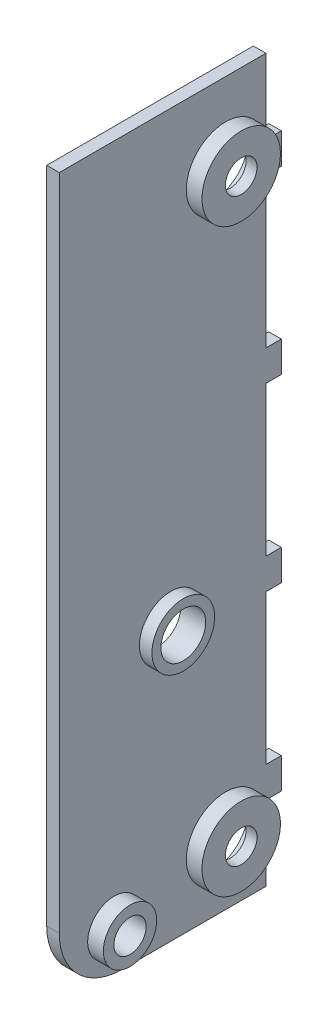
from build123d import *

# Parameters (mm, degrees)
SKETCH1_W            = 200
SKETCH1_H            = 230
BOSS_EXTRUDE1_DEPTH  = 70
SKETCH2_W            = 192
SKETCH2_H            = 222
CUT_EXTRUDE1_DEPTH   = 66
SKETCH4_W            = 196
SKETCH4_H            = 25
CUT_EXTRUDE3_DEPTH   = 10
SKETCH10_R           = 5
CUT_EXTRUDE8_DEPTH   = 167.075284133
SKETCH11_W           = 2
SKETCH11_H           = 10
BOSS_EXTRUDE2_DEPTH  = 20
SKETCH12_W           = 2
SKETCH12_H           = 5
CUT_EXTRUDE9_DEPTH   = 20
FILLET1_R            = 2.5
SKETCH13_W           = 2
SKETCH13_H           = 10
BOSS_EXTRUDE3_DEPTH  = 20
SKETCH14_W           = 2
SKETCH14_H           = 5
CUT_EXTRUDE10_DEPTH  = 20
FILLET2_R            = 2.5
SKETCH15_W           = 192
SKETCH15_H           = 66
CUT_EXTRUDE11_DEPTH  = 267.458251889
BOSS_EXTRUDE4_DEPTH  = 2
SKETCH18_R           = 7.15
CUT_EXTRUDE12_DEPTH  = 248.638849941
SKETCH19_R           = 5.05
CUT_EXTRUDE13_DEPTH  = 248.638849941
SKETCH20_R           = 5.05
CUT_EXTRUDE14_DEPTH  = 248.638849941
BOSS_EXTRUDE5_START  = 2
BOSS_EXTRUDE5_DEPTH  = 2
SKETCH21_W           = 20
SKETCH21_H           = 10
CUT_EXTRUDE15_DEPTH  = 248.638849941
SKETCH22_W           = 92
SKETCH22_H           = 40
CUT_EXTRUDE16_DEPTH  = 10
SKETCH24_R           = 5.15
CUT_EXTRUDE18_DEPTH  = 242.091269025
FILLET3_R            = 20
FILLET4_R            = 20
SKETCH25_W           = 200
SKETCH25_H           = 4.119110625
CUT_EXTRUDE19_DEPTH  = 261.384331326
SKETCH26_W           = 4
SKETCH26_H           = 65.880889375
CUT_EXTRUDE20_DEPTH  = 261.384331326
SKETCH27_W           = 4
SKETCH27_H           = 9.8
BOSS_EXTRUDE6_DEPTH  = 4.9
SKETCH28_W           = 4
SKETCH28_H           = 9.8
BOSS_EXTRUDE7_DEPTH  = 4.9
SKETCH29_R           = 12.5
SKETCH29_R_2         = 5.05
BOSS_EXTRUDE8_DEPTH  = 9
SKETCH30_R           = 8.5
SKETCH30_R_2         = 5.15
BOSS_EXTRUDE9_DEPTH  = 5
SKETCH32_R           = 10
SKETCH32_R_2         = 7.15
BOSS_EXTRUDE10_DEPTH = 4
SKETCH33_R           = 11.2
CUT_EXTRUDE21_DEPTH  = 5.5


with BuildPart() as part:
    # Sketch1 → Boss-Extrude1 (new body)
    with BuildSketch(Plane.XY):
        Rectangle(SKETCH1_W, SKETCH1_H)
    extrude(amount=BOSS_EXTRUDE1_DEPTH)

    # Sketch2 → Cut-Extrude1 (cut)
    with BuildSketch(Plane.XY.offset(70)):
        Rectangle(SKETCH2_W, SKETCH2_H)
    extrude(amount=-CUT_EXTRUDE1_DEPTH, mode=Mode.SUBTRACT)

    # Sketch4 → Cut-Extrude3 (cut)
    with BuildSketch(Plane.XZ.offset(115)):
        with Locations((0, 57.5)):
            Rectangle(SKETCH4_W, SKETCH4_H)
    extrude(amount=-CUT_EXTRUDE3_DEPTH, mode=Mode.SUBTRACT)

    # Sketch10 → Cut-Extrude8 (cut, through all)
    with BuildSketch(Plane.XY.offset(4)):
        with Locations((0, -11)):
            Circle(SKETCH10_R)
    extrude(amount=-CUT_EXTRUDE8_DEPTH, mode=Mode.SUBTRACT)

    # Sketch11 → Boss-Extrude2 (add)
    with BuildSketch(Plane.XY.offset(70)):
        with Locations((-99, -110)):
            Rectangle(SKETCH11_W, SKETCH11_H)
    extrude(amount=BOSS_EXTRUDE2_DEPTH)

    # Sketch12 → Cut-Extrude9 (cut)
    with BuildSketch(Plane.XY.offset(90)):
        with Locations((-99, -110)):
            Rectangle(SKETCH12_W, SKETCH12_H)
    extrude(amount=-CUT_EXTRUDE9_DEPTH, mode=Mode.SUBTRACT)

    # Fillet1
    fillet1_edges = [part.edges().sort_by_distance(p)[0] for p in [
        (-99, -112.5, 70),
        (-99, -107.5, 70),
    ]]
    fillet(fillet1_edges, radius=FILLET1_R - 0.0001)  # a hair under: the kernel refuses the full size

    # Sketch13 → Boss-Extrude3 (add)
    with BuildSketch(Plane.XY.offset(70)):
        with Locations((99, -110)):
            Rectangle(SKETCH13_W, SKETCH13_H)
    extrude(amount=BOSS_EXTRUDE3_DEPTH)

    # Sketch14 → Cut-Extrude10 (cut)
    with BuildSketch(Plane.XY.offset(90)):
        with Locations((99, -110)):
            Rectangle(SKETCH14_W, SKETCH14_H)
    extrude(amount=-CUT_EXTRUDE10_DEPTH, mode=Mode.SUBTRACT)

    # Fillet2
    fillet2_edges = [part.edges().sort_by_distance(p)[0] for p in [
        (99, -112.5, 70),
        (99, -107.5, 70),
    ]]
    fillet(fillet2_edges, radius=FILLET2_R - 0.0001)  # a hair under: the kernel refuses the full size

    # Sketch15 → Cut-Extrude11 (cut, through all)
    with BuildSketch(Plane(origin=(0, 115, 0), x_dir=(1, 0, 0), z_dir=(0, 1, 0))):
        with Locations((0, -37)):
            Rectangle(SKETCH15_W, SKETCH15_H)
    extrude(amount=-CUT_EXTRUDE11_DEPTH, mode=Mode.SUBTRACT)

    # Sketch16 → Boss-Extrude4 (add)
    with BuildSketch(Plane(origin=(-98, 0, 0), x_dir=(0, 0, -1), z_dir=(1, 0, 0))):
        with BuildLine():
            Line((-90, -107.5), (-72.5, -107.5))
            ThreePointArc((-72.5, -107.5), (-70, -110), (-72.5, -112.5))
            Line((-72.5, -112.5), (-90, -112.5))
            Line((-90, -112.5), (-90, -115))
            Line((-90, -115), (-45, -115))
            Line((-45, -115), (-45, -105))
            Line((-45, -105), (-90, -105))
            Line((-90, -105), (-90, -107.5))
        make_face()
    extrude(amount=BOSS_EXTRUDE4_DEPTH)

    # Sketch18 → Cut-Extrude12 (cut, through all)
    with BuildSketch(Plane(origin=(100, 0, 0), x_dir=(0, 0, -1), z_dir=(1, 0, 0))):
        with Locations((-34.45, -28.4)):
            Circle(SKETCH18_R)
    extrude(amount=-CUT_EXTRUDE12_DEPTH, mode=Mode.SUBTRACT)

    # Sketch19 → Cut-Extrude13 (cut, through all)
    with BuildSketch(Plane(origin=(100, 0, 0), x_dir=(0, 0, -1), z_dir=(1, 0, 0))):
        with Locations((-17, -95)):
            Circle(SKETCH19_R)
    extrude(amount=-CUT_EXTRUDE13_DEPTH, mode=Mode.SUBTRACT)

    # Sketch20 → Cut-Extrude14 (cut, through all)
    with BuildSketch(Plane(origin=(100, 0, 0), x_dir=(0, 0, -1), z_dir=(1, 0, 0))):
        with Locations((-17, 90)):
            Circle(SKETCH20_R)
    extrude(amount=-CUT_EXTRUDE14_DEPTH, mode=Mode.SUBTRACT)

    # Sketch17 → Boss-Extrude5 (add)
    with BuildSketch(Plane.ZY.offset(-98).offset(BOSS_EXTRUDE5_START)):
        with BuildLine():
            Line((90, -107.5), (72.5, -107.5))
            ThreePointArc((72.5, -107.5), (70, -110), (72.5, -112.5))
            Line((72.5, -112.5), (90, -112.5))
            Line((90, -112.5), (90, -115))
            Line((90, -115), (45, -115))
            Line((45, -115), (45, -105))
            Line((45, -105), (90, -105))
            Line((90, -105), (90, -107.5))
        make_face()
    extrude(amount=-BOSS_EXTRUDE5_DEPTH)

    # Sketch21 → Cut-Extrude15 (cut, through all)
    with BuildSketch(Plane(origin=(100, 0, 0), x_dir=(0, 0, -1), z_dir=(1, 0, 0))):
        with Locations((-80, -110)):
            Rectangle(SKETCH21_W, SKETCH21_H)
    extrude(amount=-CUT_EXTRUDE15_DEPTH, mode=Mode.SUBTRACT)

    # Sketch22 → Cut-Extrude16 (cut)
    with BuildSketch(Plane.XY.offset(4)):
        with Locations((0, 95)):
            Rectangle(SKETCH22_W, SKETCH22_H)
    extrude(amount=-CUT_EXTRUDE16_DEPTH, mode=Mode.SUBTRACT)

    # Sketch24 → Cut-Extrude18 (cut, through all)
    with BuildSketch(Plane(origin=(100, 0, 0), x_dir=(0, 0, -1), z_dir=(1, 0, 0))):
        with Locations((-52.45, -102)):
            Circle(SKETCH24_R)
    extrude(amount=-CUT_EXTRUDE18_DEPTH, mode=Mode.SUBTRACT)

    # Fillet3
    fillet3_edges = [part.edges().sort_by_distance(p)[0] for p in [
        (98, -115, 70),
    ]]
    fillet(fillet3_edges, radius=FILLET3_R)

    # Fillet4
    fillet4_edges = [part.edges().sort_by_distance(p)[0] for p in [
        (-98, -115, 70),
    ]]
    fillet(fillet4_edges, radius=FILLET4_R)

    # Sketch25 → Cut-Extrude19 (cut, through all)
    with BuildSketch(Plane(origin=(0, 115, 0), x_dir=(1, 0, 0), z_dir=(0, 1, 0))):
        with Locations((0, -2.059555313)):
            Rectangle(SKETCH25_W, SKETCH25_H)
    extrude(amount=-CUT_EXTRUDE19_DEPTH, mode=Mode.SUBTRACT)


with BuildPart() as cut_extrude19_piece_1:
    # of the separate pieces the step leaves, piece 1, a body of its own (cut_extrude19_pieces)
    add(part.part.solids().sort_by_distance((100, -115, 4.119110625))[0])

    # Sketch27 → Boss-Extrude6 (add)
    with BuildSketch(Plane(origin=(0, 0, 4.119110625), x_dir=(-1, 0, 0), z_dir=(0, 0, -1))):
        with Locations((-98, -86.25)):
            Rectangle(SKETCH27_W, SKETCH27_H)
    boss_extrude6 = extrude(amount=BOSS_EXTRUDE6_DEPTH)

    # Sketch28 → Boss-Extrude7 (add)
    with BuildSketch(Plane(origin=(0, 0, 4.119110625), x_dir=(-1, 0, 0), z_dir=(0, 0, -1))):
        with Locations((-98, -28.75)):
            Rectangle(SKETCH28_W, SKETCH28_H)
    boss_extrude7 = extrude(amount=BOSS_EXTRUDE7_DEPTH)

    # Mirror1: Boss-Extrude6, Boss-Extrude7 across plane
    add(boss_extrude6.mirror(Plane.ZX))
    add(boss_extrude7.mirror(Plane.ZX))

    # Sketch29 → Boss-Extrude8 (add)
    with BuildSketch(Plane.ZY.offset(-96)):
        with Locations((17, 90)):
            Circle(SKETCH29_R)
        with Locations(Location((17, 90, 0), (0, 0, 180))):
            Circle(SKETCH29_R_2, mode=Mode.SUBTRACT)
    boss_extrude8 = extrude(amount=-BOSS_EXTRUDE8_DEPTH)

    # Sketch30 → Boss-Extrude9 (add)
    with BuildSketch(Plane(origin=(100, 0, 0), x_dir=(0, 0, -1), z_dir=(1, 0, 0))):
        with Locations(Location((-52.45, -102, 0), (0, 0, 180))):
            Circle(SKETCH30_R)
        with Locations((-52.45, -102)):
            Circle(SKETCH30_R_2, mode=Mode.SUBTRACT)
    extrude(amount=BOSS_EXTRUDE9_DEPTH)

    # Sketch32 → Boss-Extrude10 (add)
    with BuildSketch(Plane(origin=(100, 0, 0), x_dir=(0, 0, -1), z_dir=(1, 0, 0))):
        with Locations(Location((-34.45, -28.4, 0), (0, 0, 180))):
            Circle(SKETCH32_R)
        with Locations((-34.45, -28.4)):
            Circle(SKETCH32_R_2, mode=Mode.SUBTRACT)
    extrude(amount=BOSS_EXTRUDE10_DEPTH)

    # Sketch33 → Cut-Extrude21 (cut)
    with BuildSketch(Plane.ZY.offset(-96)):
        with Locations((17, 90)):
            Circle(SKETCH33_R)
    cut_extrude21 = extrude(amount=-CUT_EXTRUDE21_DEPTH, mode=Mode.SUBTRACT)

    # Mirror2: Boss-Extrude8, Cut-Extrude21 across plane
    add(boss_extrude8.mirror(Plane.ZX.offset(-2.5)))
    add(cut_extrude21.mirror(Plane.ZX.offset(-2.5)), mode=Mode.SUBTRACT)


with BuildPart() as cut_extrude19_piece_2:
    # of the separate pieces the step leaves, piece 2, a body of its own (cut_extrude19_pieces)
    add(part.part.solids().sort_by_distance((-100, -115, 50))[0])

    # Sketch26 → Cut-Extrude20 (cut, through all)
    with BuildSketch(Plane(origin=(0, 115, 0), x_dir=(1, 0, 0), z_dir=(0, 1, 0))):
        with Locations((-98, -37.059555313)):
            Rectangle(SKETCH26_W, SKETCH26_H)
    extrude(amount=-CUT_EXTRUDE20_DEPTH, mode=Mode.SUBTRACT)


solid = cut_extrude19_piece_1.part
